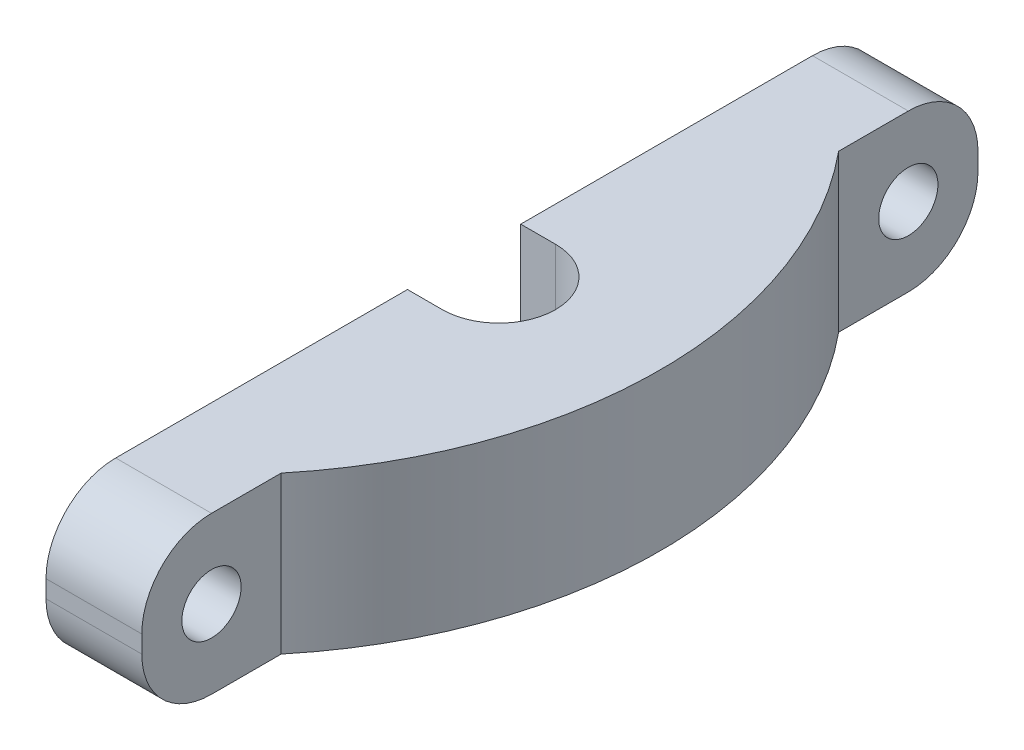
from build123d import *

# Parameters (mm, degrees)
BOSS_EXTRUDE1_DEPTH  = 11.25
CUT_EXTRUDE1_DEPTH   = 28.99218641
M3_CLEARANCE_HOLE1_D = 3.4
CUT_EXTRUDE2_DEPTH   = 28.99218641


with BuildPart() as part:
    # Sketch1 → Boss-Extrude1 (new body)
    with BuildSketch(Plane(origin=(0, 0, 0), x_dir=(0, 0, -1), z_dir=(1, 0, 0))):
        with BuildLine():
            Line((-24, 0.5), (-24, -0.5))
            ThreePointArc((-24, -0.5), (-22.828427125, -3.328427125), (-20, -4.5))
            Line((-20, -4.5), (20, -4.5))
            ThreePointArc((20, -4.5), (22.828427125, -3.328427125), (24, -0.5))
            Line((24, -0.5), (24, 0.5))
            ThreePointArc((24, 0.5), (22.828427125, 3.328427125), (20, 4.5))
            Line((20, 4.5), (-20, 4.5))
            ThreePointArc((-20, 4.5), (-22.828427125, 3.328427125), (-24, 0.5))
        make_face()
    extrude(amount=BOSS_EXTRUDE1_DEPTH)

    # Sketch2 → Cut-Extrude1 (cut, through all)
    with BuildSketch(Plane(origin=(0, -4.5, 0), x_dir=(-1, 0, 0), z_dir=(0, -1, 0))):
        with BuildLine():
            Line((-2, -3.25), (0, -3.25))
            Line((0, -3.25), (0, 3.25))
            Line((0, 3.25), (-2, 3.25))
            ThreePointArc((-2, 3.25), (-5.25, 0), (-2, -3.25))
        make_face()
    extrude(amount=-CUT_EXTRUDE1_DEPTH, mode=Mode.SUBTRACT)

    # M3 Clearance Hole1 (through all)
    with Locations(Plane(origin=(11.25, 0, 0), x_dir=(0, 0, -1), z_dir=(1, 0, 0))):
        with Locations((-20, 0), (20, 0)):
            Hole(M3_CLEARANCE_HOLE1_D / 2)

    # Sketch7 → Cut-Extrude2 (cut, through all)
    with BuildSketch(Plane(origin=(0, -4.5, 0), x_dir=(-1, 0, 0), z_dir=(0, -1, 0))):
        with BuildLine():
            Line((-11.25, -24), (-5.5, -24))
            Line((-5.5, -24), (-5.5, -16))
            ThreePointArc((-5.5, -16), (-9.768861754, -8.500919068), (-11.25, 0))
            Line((-11.25, 0), (-11.25, -24))
        make_face()
        with BuildLine():
            ThreePointArc((-11.25, 0), (-9.768861754, 8.500919068), (-5.5, 16))
            Line((-5.5, 16), (-5.5, 24))
            Line((-5.5, 24), (-11.25, 24))
            Line((-11.25, 24), (-11.25, 0))
        make_face()
    extrude(amount=-CUT_EXTRUDE2_DEPTH, mode=Mode.SUBTRACT)


solid = part.part
